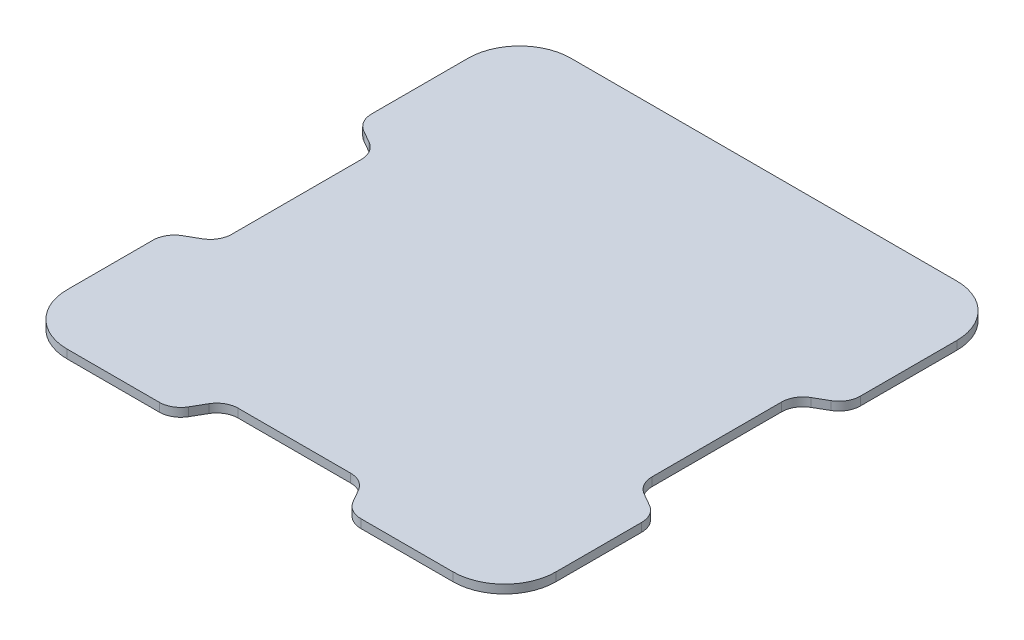
from build123d import *

# Parameters (mm, degrees)
BOSS_EXTRUDE1_START = -2
BOSS_EXTRUDE1_DEPTH = 2
FILLET1_R           = 12
FILLET2_R           = 5
FILLET3_R           = 5


with BuildPart() as part:
    # Boss-Extrude1: read off the stored shape, not the designer's step
    # Boss-Extrude1 outline → Boss-Extrude1 (new body)
    with BuildSketch(Plane(origin=(0, 0, 0), x_dir=(1, 0, 0), z_dir=(0, 1, 0)).offset(BOSS_EXTRUDE1_START)):
        Polygon((57, 35.118802154), (57, 72.5), (-57, 72.5), (-57, 35.118802154), (-49, 30.5), (-49, -5.5), (-57, -10.118802154), (-57, -45), (-20.618802154, -45), (-16, -37), (16, -37), (20.618802154, -45), (57, -45), (57, -10.118802154), (49, -5.5), (49, 30.5), align=None)
    extrude(amount=BOSS_EXTRUDE1_DEPTH)

    # Fillet1
    fillet1_edges = [part.edges().sort_by_distance(p)[0] for p in [
        (57, -1, 45),
        (-57, -1, 45),
        (-57, -1, -72.5),
        (57, -1, -72.5),
    ]]
    fillet(fillet1_edges, radius=FILLET1_R)

    # Fillet2
    fillet2_edges = [part.edges().sort_by_distance(p)[0] for p in [
        (57, -1, -35.118802154),
        (57, -1, 10.118802154),
        (20.618802154, -1, 45),
        (-20.618802154, -1, 45),
        (-57, -1, 10.118802154),
        (-57, -1, -35.118802154),
    ]]
    fillet(fillet2_edges, radius=FILLET2_R)

    # Fillet3
    fillet3_edges = [part.edges().sort_by_distance(p)[0] for p in [
        (49, -1, -30.5),
        (49, -1, 5.5),
        (16, -1, 37),
        (-16, -1, 37),
        (-49, -1, 5.5),
        (-49, -1, -30.5),
    ]]
    fillet(fillet3_edges, radius=FILLET3_R)


solid = part.part
